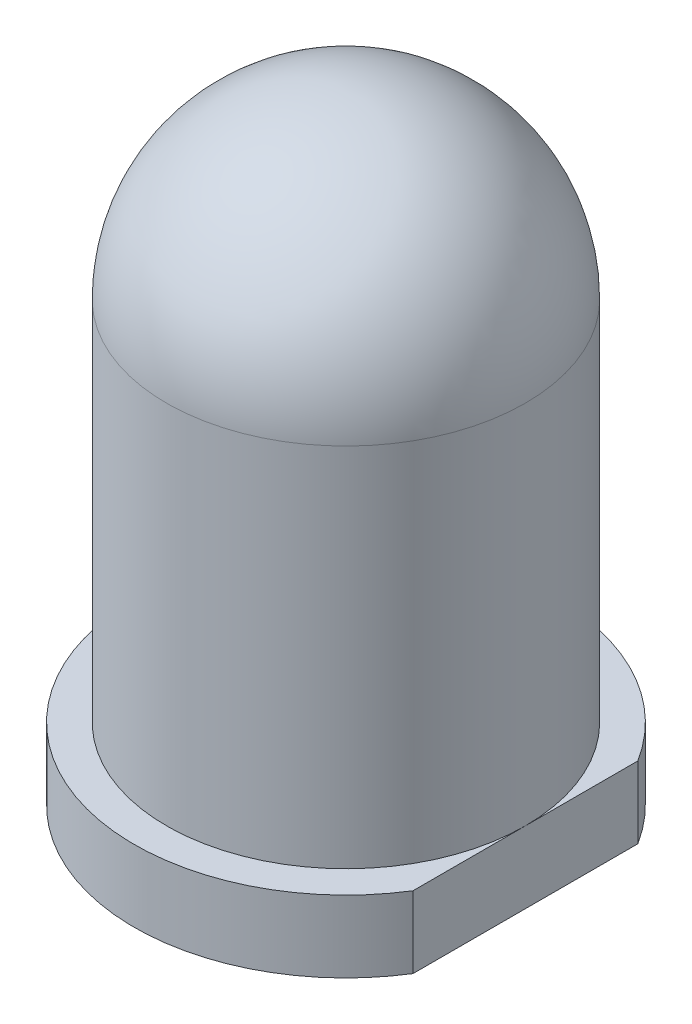
from build123d import *

# Parameters (mm, degrees)
BOSS_EXTRUDE1_DEPTH = 1


with BuildPart() as part:
    # Sketch1 → Revolve1 (revolve)
    with BuildSketch(Plane.XY):
        with BuildLine():
            Line((2.5, 4.02324589), (2.5, -1.07675411))
            Line((2.5, -1.07675411), (0, -1.07675411))
            Line((0, -1.07675411), (0, 6.52324589))
            ThreePointArc((0, 6.52324589), (1.767766953, 5.791012843), (2.5, 4.02324589))
        make_face()
    revolve(axis=Axis((0, -170.01390881, 0), (0, 1, 0)))

    # Sketch2 → Boss-Extrude1 (add)
    with BuildSketch(Plane.XZ.offset(1.07675411)):
        with BuildLine():
            Line((2.5, -1.566045976), (2.5, 1.566045976))
            ThreePointArc((2.5, 1.566045976), (-2.95, 0), (2.5, -1.566045976))
        make_face()
    extrude(amount=BOSS_EXTRUDE1_DEPTH)


solid = part.part
